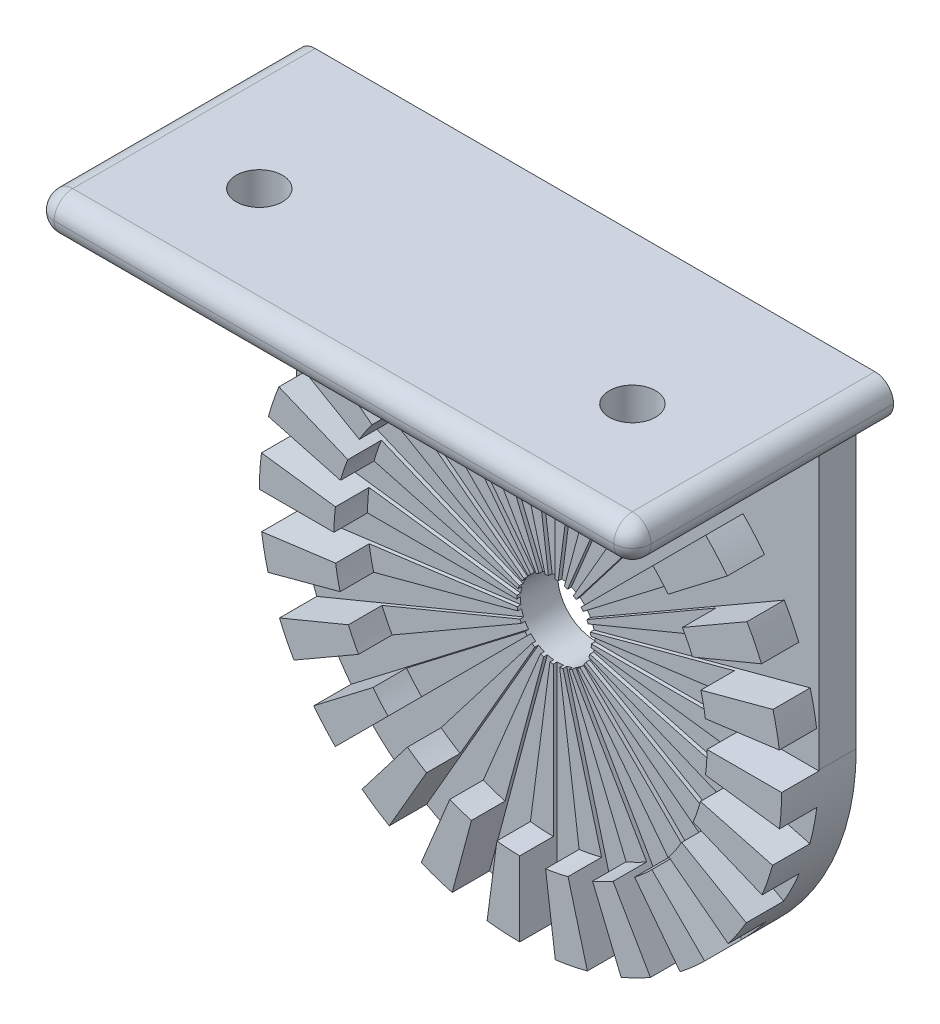
from build123d import *

# Parameters (mm, degrees)
BOSS_EXTRUDE2_DEPTH     = 10
BOSS_EXTRUDE2_2_DEPTH   = 10
BOSS_EXTRUDE2_3_DEPTH   = 10
BOSS_EXTRUDE2_4_DEPTH   = 10
BOSS_EXTRUDE2_5_DEPTH   = 10
BOSS_EXTRUDE2_6_DEPTH   = 10
BOSS_EXTRUDE2_7_DEPTH   = 10
BOSS_EXTRUDE2_8_DEPTH   = 10
BOSS_EXTRUDE2_9_DEPTH   = 10
BOSS_EXTRUDE2_10_DEPTH  = 10
BOSS_EXTRUDE2_11_DEPTH  = 10
BOSS_EXTRUDE2_12_DEPTH  = 10
BOSS_EXTRUDE2_13_DEPTH  = 10
BOSS_EXTRUDE2_14_DEPTH  = 10
BOSS_EXTRUDE2_15_DEPTH  = 10
BOSS_EXTRUDE2_16_DEPTH  = 10
BOSS_EXTRUDE2_17_DEPTH  = 10
BOSS_EXTRUDE2_18_DEPTH  = 10
BOSS_EXTRUDE2_19_DEPTH  = 10
BOSS_EXTRUDE2_20_DEPTH  = 10
BOSS_EXTRUDE2_21_DEPTH  = 10
BOSS_EXTRUDE2_22_DEPTH  = 10
BOSS_EXTRUDE2_23_DEPTH  = 10
BOSS_EXTRUDE2_24_DEPTH  = 10
SKETCH1_5_R             = 35
BOSS_EXTRUDE3_DEPTH     = 5
CUT_EXTRUDE1_DEPTH      = 51.497524692
CUT_EXTRUDE1_DEPTH_BACK = 51.497524692
SKETCH3_R               = 5
CUT_EXTRUDE6_START      = 5.5
SKETCH9_R               = 25
CUT_EXTRUDE6_DEPTH      = 5.5
SKETCH4_W               = 80
SKETCH4_H               = 35
BOSS_EXTRUDE4_DEPTH     = 5
SKETCH6_R               = 3.1
CUT_EXTRUDE2_DEPTH      = 97.046863561
BOSS_EXTRUDE5_DEPTH     = 5
FILLET2_R               = 2.5


with BuildPart() as part:
    # Sketch1 → Boss-Extrude2 (new body)
    with BuildSketch(Plane.XY):
        with BuildLine():
            Line((-34.999857143, 0.1), (-1.525705169, 0.1))
            Line((-1.525705169, 0.1), (-34.713481132, 4.469253595))
            ThreePointArc((-34.713481132, 4.469253595), (-34.925062313, 2.289109523), (-34.999857143, 0.1))
        make_face()
    extrude(amount=BOSS_EXTRUDE2_DEPTH)



with BuildPart() as body_2:
    # Sketch1 → Boss-Extrude2 2 (new body)
    with BuildSketch(Plane.XY):
        with BuildLine():
            ThreePointArc((-32.373919998, 13.30147751), (-33.142554532, 11.250381286), (-33.781384026, 9.155222187))
            Line((-33.781384026, 9.155222187), (-1.447836121, 0.491474138))
            Line((-1.447836121, 0.491474138), (-32.373919998, 13.30147751))
        make_face()
    extrude(amount=BOSS_EXTRUDE2_2_DEPTH)


with BuildPart() as body_3:
    # Sketch1 → Boss-Extrude2 3 (new body)
    with BuildSketch(Plane.XY):
        with BuildLine():
            ThreePointArc((-27.828129717, 21.227227715), (-29.101436431, 19.444958156), (-30.260765414, 17.586531112))
            Line((-30.260765414, 17.586531112), (-1.271299435, 0.849455125))
            Line((-1.271299435, 0.849455125), (-27.828129717, 21.227227715))
        make_face()
    extrude(amount=BOSS_EXTRUDE2_3_DEPTH)


with BuildPart() as body_4:
    # Sketch1 → Boss-Extrude2 4 (new body)
    with BuildSketch(Plane.XY):
        with BuildLine():
            ThreePointArc((-21.385898383, 27.706377431), (-23.077103529, 26.314393262), (-24.677925648, 24.819347004))
            Line((-24.677925648, 24.819347004), (-1.008125793, 1.149547149))
            Line((-1.008125793, 1.149547149), (-21.385898383, 27.706377431))
        make_face()
    extrude(amount=BOSS_EXTRUDE2_4_DEPTH)


with BuildPart() as body_5:
    # Sketch1 → Boss-Extrude2 5 (new body)
    with BuildSketch(Plane.XY):
        with BuildLine():
            ThreePointArc((-13.486253417, 32.297383312), (-15.480104158, 31.390545954), (-17.413326031, 30.360765414))
            Line((-17.413326031, 30.360765414), (-0.676250044, 1.371299435))
            Line((-0.676250044, 1.371299435), (-13.486253417, 32.297383312))
        make_face()
    extrude(amount=BOSS_EXTRUDE2_5_DEPTH)


with BuildPart() as body_6:
    # Sketch1 → Boss-Extrude2 6 (new body)
    with BuildSketch(Plane.XY):
        with BuildLine():
            ThreePointArc((-4.667542567, 34.687375894), (-6.828161271, 34.327484814), (-8.962037022, 33.833147835))
            Line((-8.962037022, 33.833147835), (-0.298288972, 1.49959993))
            Line((-0.298288972, 1.49959993), (-4.667542567, 34.687375894))
        make_face()
    extrude(amount=BOSS_EXTRUDE2_6_DEPTH)


with BuildPart() as body_7:
    # Sketch1 → Boss-Extrude2 7 (new body)
    with BuildSketch(Plane.XY):
        with BuildLine():
            ThreePointArc((4.469253595, 34.713481132), (2.289109523, 34.925062313), (0.1, 34.999857143))
            Line((0.1, 34.999857143), (0.1, 1.525705169))
            Line((0.1, 1.525705169), (4.469253595, 34.713481132))
        make_face()
    extrude(amount=BOSS_EXTRUDE2_7_DEPTH)


with BuildPart() as body_8:
    # Sketch1 → Boss-Extrude2 8 (new body)
    with BuildSketch(Plane.XY):
        with BuildLine():
            ThreePointArc((13.30147751, 32.373919998), (11.250381286, 33.142554532), (9.155222187, 33.781384026))
            Line((9.155222187, 33.781384026), (0.491474138, 1.447836121))
            Line((0.491474138, 1.447836121), (13.30147751, 32.373919998))
        make_face()
    extrude(amount=BOSS_EXTRUDE2_8_DEPTH)


with BuildPart() as body_9:
    # Sketch1 → Boss-Extrude2 9 (new body)
    with BuildSketch(Plane.XY):
        with BuildLine():
            ThreePointArc((21.227227715, 27.828129717), (19.444958156, 29.101436431), (17.586531112, 30.260765414))
            Line((17.586531112, 30.260765414), (0.849455125, 1.271299435))
            Line((0.849455125, 1.271299435), (21.227227715, 27.828129717))
        make_face()
    extrude(amount=BOSS_EXTRUDE2_9_DEPTH)


with BuildPart() as body_10:
    # Sketch1 → Boss-Extrude2 10 (new body)
    with BuildSketch(Plane.XY):
        with BuildLine():
            ThreePointArc((27.706377431, 21.385898383), (26.314393262, 23.077103529), (24.819347004, 24.677925648))
            Line((24.819347004, 24.677925648), (1.149547149, 1.008125793))
            Line((1.149547149, 1.008125793), (27.706377431, 21.385898383))
        make_face()
    extrude(amount=BOSS_EXTRUDE2_10_DEPTH)


with BuildPart() as body_11:
    # Sketch1 → Boss-Extrude2 11 (new body)
    with BuildSketch(Plane.XY):
        with BuildLine():
            ThreePointArc((32.297383312, 13.486253417), (31.390545954, 15.480104158), (30.360765414, 17.413326031))
            Line((30.360765414, 17.413326031), (1.371299435, 0.676250044))
            Line((1.371299435, 0.676250044), (32.297383312, 13.486253417))
        make_face()
    extrude(amount=BOSS_EXTRUDE2_11_DEPTH)


with BuildPart() as body_12:
    # Sketch1 → Boss-Extrude2 12 (new body)
    with BuildSketch(Plane.XY):
        with BuildLine():
            ThreePointArc((34.687375894, 4.667542567), (34.327484814, 6.828161271), (33.833147835, 8.962037022))
            Line((33.833147835, 8.962037022), (1.49959993, 0.298288972))
            Line((1.49959993, 0.298288972), (34.687375894, 4.667542567))
        make_face()
    extrude(amount=BOSS_EXTRUDE2_12_DEPTH)


with BuildPart() as body_13:
    # Sketch1 → Boss-Extrude2 13 (new body)
    with BuildSketch(Plane.XY):
        with BuildLine():
            Line((1.525705169, -0.1), (34.713481132, -4.469253595))
            ThreePointArc((34.713481132, -4.469253595), (34.925062313, -2.289109523), (34.999857143, -0.1))
            Line((34.999857143, -0.1), (1.525705169, -0.1))
        make_face()
    extrude(amount=BOSS_EXTRUDE2_13_DEPTH)


with BuildPart() as body_14:
    # Sketch1 → Boss-Extrude2 14 (new body)
    with BuildSketch(Plane.XY):
        with BuildLine():
            Line((1.447836121, -0.491474138), (32.373919998, -13.30147751))
            ThreePointArc((32.373919998, -13.30147751), (33.142554532, -11.250381286), (33.781384026, -9.155222187))
            Line((33.781384026, -9.155222187), (1.447836121, -0.491474138))
        make_face()
    extrude(amount=BOSS_EXTRUDE2_14_DEPTH)


with BuildPart() as body_15:
    # Sketch1 → Boss-Extrude2 15 (new body)
    with BuildSketch(Plane.XY):
        with BuildLine():
            Line((1.271299435, -0.849455125), (27.828129717, -21.227227715))
            ThreePointArc((27.828129717, -21.227227715), (29.101436431, -19.444958156), (30.260765414, -17.586531112))
            Line((30.260765414, -17.586531112), (1.271299435, -0.849455125))
        make_face()
    extrude(amount=BOSS_EXTRUDE2_15_DEPTH)


with BuildPart() as body_16:
    # Sketch1 → Boss-Extrude2 16 (new body)
    with BuildSketch(Plane.XY):
        with BuildLine():
            Line((1.008125793, -1.149547149), (21.385898383, -27.706377431))
            ThreePointArc((21.385898383, -27.706377431), (23.077103529, -26.314393262), (24.677925648, -24.819347004))
            Line((24.677925648, -24.819347004), (1.008125793, -1.149547149))
        make_face()
    extrude(amount=BOSS_EXTRUDE2_16_DEPTH)


with BuildPart() as body_17:
    # Sketch1 → Boss-Extrude2 17 (new body)
    with BuildSketch(Plane.XY):
        with BuildLine():
            Line((0.676250044, -1.371299435), (13.486253417, -32.297383312))
            ThreePointArc((13.486253417, -32.297383312), (15.480104158, -31.390545954), (17.413326031, -30.360765414))
            Line((17.413326031, -30.360765414), (0.676250044, -1.371299435))
        make_face()
    extrude(amount=BOSS_EXTRUDE2_17_DEPTH)


with BuildPart() as body_18:
    # Sketch1 → Boss-Extrude2 18 (new body)
    with BuildSketch(Plane.XY):
        with BuildLine():
            Line((0.298288972, -1.49959993), (4.667542567, -34.687375894))
            ThreePointArc((4.667542567, -34.687375894), (6.828161271, -34.327484814), (8.962037022, -33.833147835))
            Line((8.962037022, -33.833147835), (0.298288972, -1.49959993))
        make_face()
    extrude(amount=BOSS_EXTRUDE2_18_DEPTH)


with BuildPart() as body_19:
    # Sketch1 → Boss-Extrude2 19 (new body)
    with BuildSketch(Plane.XY):
        with BuildLine():
            Line((-0.1, -1.525705169), (-4.469253595, -34.713481132))
            ThreePointArc((-4.469253595, -34.713481132), (-2.289109523, -34.925062313), (-0.1, -34.999857143))
            Line((-0.1, -34.999857143), (-0.1, -1.525705169))
        make_face()
    extrude(amount=BOSS_EXTRUDE2_19_DEPTH)


with BuildPart() as body_20:
    # Sketch1 → Boss-Extrude2 20 (new body)
    with BuildSketch(Plane.XY):
        with BuildLine():
            Line((-0.491474138, -1.447836121), (-13.30147751, -32.373919998))
            ThreePointArc((-13.30147751, -32.373919998), (-11.250381286, -33.142554532), (-9.155222187, -33.781384026))
            Line((-9.155222187, -33.781384026), (-0.491474138, -1.447836121))
        make_face()
    extrude(amount=BOSS_EXTRUDE2_20_DEPTH)


with BuildPart() as body_21:
    # Sketch1 → Boss-Extrude2 21 (new body)
    with BuildSketch(Plane.XY):
        with BuildLine():
            Line((-0.849455125, -1.271299435), (-21.227227715, -27.828129717))
            ThreePointArc((-21.227227715, -27.828129717), (-19.444958156, -29.101436431), (-17.586531112, -30.260765414))
            Line((-17.586531112, -30.260765414), (-0.849455125, -1.271299435))
        make_face()
    extrude(amount=BOSS_EXTRUDE2_21_DEPTH)


with BuildPart() as body_22:
    # Sketch1 → Boss-Extrude2 22 (new body)
    with BuildSketch(Plane.XY):
        with BuildLine():
            Line((-1.149547149, -1.008125793), (-27.706377431, -21.385898383))
            ThreePointArc((-27.706377431, -21.385898383), (-26.314393262, -23.077103529), (-24.819347004, -24.677925648))
            Line((-24.819347004, -24.677925648), (-1.149547149, -1.008125793))
        make_face()
    extrude(amount=BOSS_EXTRUDE2_22_DEPTH)


with BuildPart() as body_23:
    # Sketch1 → Boss-Extrude2 23 (new body)
    with BuildSketch(Plane.XY):
        with BuildLine():
            Line((-1.49959993, -0.298288972), (-34.687375894, -4.667542567))
            ThreePointArc((-34.687375894, -4.667542567), (-34.327484814, -6.828161271), (-33.833147835, -8.962037022))
            Line((-33.833147835, -8.962037022), (-1.49959993, -0.298288972))
        make_face()
    extrude(amount=BOSS_EXTRUDE2_23_DEPTH)


with BuildPart() as body_24:
    # Sketch1 → Boss-Extrude2 24 (new body)
    with BuildSketch(Plane.XY):
        with BuildLine():
            Line((-1.371299435, -0.676250044), (-32.297383312, -13.486253417))
            ThreePointArc((-32.297383312, -13.486253417), (-31.390545954, -15.480104158), (-30.360765414, -17.413326031))
            Line((-30.360765414, -17.413326031), (-1.371299435, -0.676250044))
        make_face()
    extrude(amount=BOSS_EXTRUDE2_24_DEPTH)


with BuildPart() as part_1:
    add(part.part)

    add(body_2.part)  # Boss-Extrude3 merges body 2

    add(body_3.part)  # Boss-Extrude3 merges body 3

    add(body_4.part)  # Boss-Extrude3 merges body 4

    add(body_5.part)  # Boss-Extrude3 merges body 5

    add(body_6.part)  # Boss-Extrude3 merges body 6

    add(body_7.part)  # Boss-Extrude3 merges body 7

    add(body_8.part)  # Boss-Extrude3 merges body 8

    add(body_9.part)  # Boss-Extrude3 merges body 9

    add(body_10.part)  # Boss-Extrude3 merges body 10

    add(body_11.part)  # Boss-Extrude3 merges body 11

    add(body_12.part)  # Boss-Extrude3 merges body 12

    add(body_13.part)  # Boss-Extrude3 merges body 13

    add(body_14.part)  # Boss-Extrude3 merges body 14

    add(body_15.part)  # Boss-Extrude3 merges body 15

    add(body_16.part)  # Boss-Extrude3 merges body 16

    add(body_17.part)  # Boss-Extrude3 merges body 17

    add(body_18.part)  # Boss-Extrude3 merges body 18

    add(body_19.part)  # Boss-Extrude3 merges body 19

    add(body_20.part)  # Boss-Extrude3 merges body 20

    add(body_21.part)  # Boss-Extrude3 merges body 21

    add(body_22.part)  # Boss-Extrude3 merges body 22

    add(body_23.part)  # Boss-Extrude3 merges body 23

    add(body_24.part)  # Boss-Extrude3 merges body 24
    # Sketch1<5> → Boss-Extrude3 (add)
    with BuildSketch(Plane.XY):
        with Locations(Location((0, 0, 0), (0, 0, 179.83629755))):
            Circle(SKETCH1_5_R)
    extrude(amount=BOSS_EXTRUDE3_DEPTH)

    # Sketch3 → Cut-Extrude1 (cut, two sides: drawn at the far end of the back side and taken through both)
    with BuildSketch(Plane.XY.offset(-CUT_EXTRUDE1_DEPTH_BACK)):
        Circle(SKETCH3_R)
    extrude(amount=CUT_EXTRUDE1_DEPTH + CUT_EXTRUDE1_DEPTH_BACK, mode=Mode.SUBTRACT)

    # Sketch9 → Cut-Extrude6 (cut)
    with BuildSketch(Plane.XY.offset(CUT_EXTRUDE6_START)):
        Circle(SKETCH9_R)
    extrude(amount=CUT_EXTRUDE6_DEPTH, mode=Mode.SUBTRACT)



with BuildPart() as body_2_2:
    # Sketch4 → Boss-Extrude4 (new body)
    with BuildSketch(Plane(origin=(0, 40, 0), x_dir=(1, 0, 0), z_dir=(0, 1, 0))):
        with Locations((0, -17.5)):
            Rectangle(SKETCH4_W, SKETCH4_H)
    extrude(amount=BOSS_EXTRUDE4_DEPTH)

    # Sketch6 → Cut-Extrude2 (cut, through all)
    with BuildSketch(Plane(origin=(0, 45, 0), x_dir=(1, 0, 0), z_dir=(0, 1, 0))):
        with Locations(Location((-25, -20, 0), (0, 0, 90))):
            Circle(SKETCH6_R)
        with Locations(Location((25, -20, 0), (0, 0, 270))):
            Circle(SKETCH6_R)
    extrude(amount=-CUT_EXTRUDE2_DEPTH, mode=Mode.SUBTRACT)


with BuildPart() as part_2:
    add(part_1.part)

    add(body_2_2.part)  # Boss-Extrude5 merges body 2 2
    # Sketch10 → Boss-Extrude5 (add)
    with BuildSketch(Plane.XY):
        with BuildLine():
            Line((-35, 0), (-35, 40))
            Line((-35, 40), (35, 40))
            Line((35, 40), (35, 0))
            ThreePointArc((35, 0), (0, 35), (-35, 0))
        make_face()
    extrude(amount=BOSS_EXTRUDE5_DEPTH)

    # Fillet2
    fillet2_edges = [part_2.edges().sort_by_distance(p)[0] for p in [
        (40, 45, 17.5),
        (35, 40, 2.5),
        (-35, 40, 2.5),
        (0, 40, 5),
        (0, 45, 35),
        (40, 40, 17.5),
        (-40, 40, 17.5),
        (0, 40, 35),
        (40, 42.5, 35),
        (-40, 42.5, 35),
        (-40, 45, 17.5),
    ]]
    fillet(fillet2_edges, radius=FILLET2_R - 0.0001)  # a hair under: the kernel refuses the full size


solid = part_2.part
